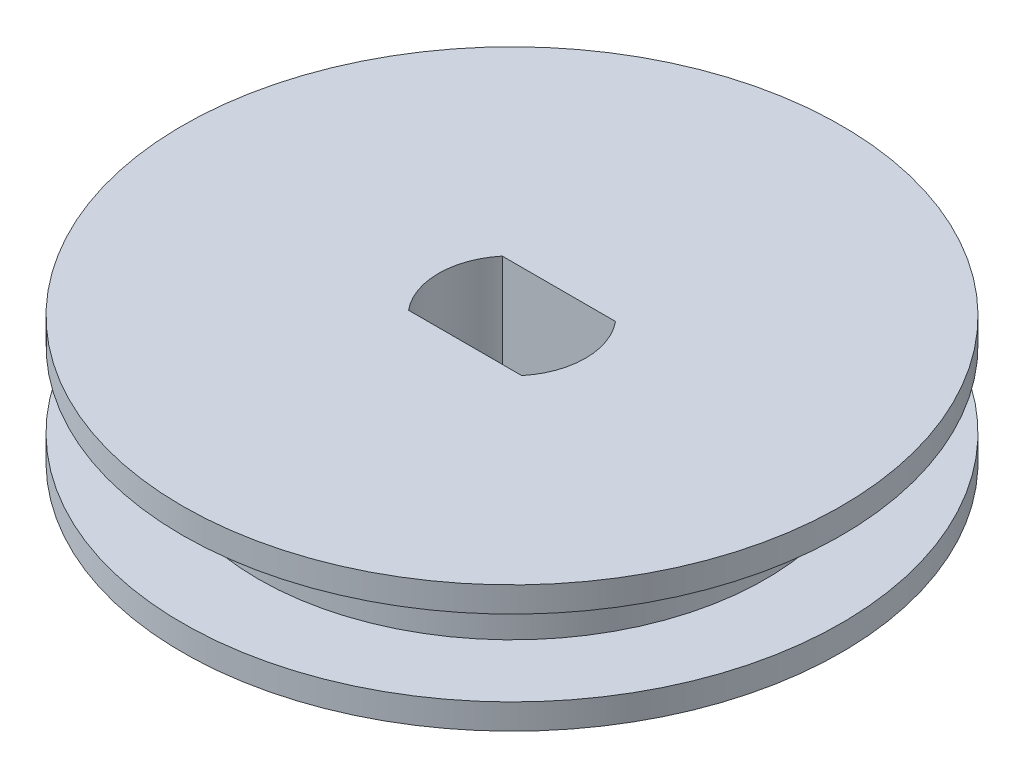
from build123d import *

# Parameters (mm, degrees)
SKETCH1_R               = 10
BOSS_EXTRUDE1_DEPTH     = 1
SKETCH2_R               = 10
BOSS_EXTRUDE2_DEPTH     = 4
SKETCH4_R               = 13
BOSS_EXTRUDE3_DEPTH     = 1
CUT_SWEEP1_START        = 4.993438222
CUT_SWEEP1_DEPTH        = 4.55597903
SKETCH9_R               = 1
CUT_EXTRUDE2_DEPTH      = 5
SKETCH10_R              = 2.5
SKETCH10_R_2            = 1
BOSS_EXTRUDE4_DEPTH     = 1
SKETCH11_R              = 13
SKETCH11_R_2            = 10
BOSS_EXTRUDE5_DEPTH     = 1
CUT_EXTRUDE4_DEPTH      = 20.05255902
CUT_EXTRUDE4_DEPTH_BACK = 20.05255902


# Read off the part's stored shape, not the designer's step: Cut-Sweep1
with BuildPart() as part:
    # Sketch1 → Boss-Extrude1 (new body)
    with BuildSketch(Plane(origin=(0, 0, 0), x_dir=(1, 0, 0), z_dir=(0, 1, 0))):
        with Locations(Location((0, 0, 0), (0, 0, 270))):
            Circle(SKETCH1_R)
    extrude(amount=BOSS_EXTRUDE1_DEPTH)

    # Sketch2 → Boss-Extrude2 (add)
    with BuildSketch(Plane(origin=(0, 0, 0), x_dir=(1, 0, 0), z_dir=(0, 1, 0))):
        with Locations(Location((0, 0, 0), (0, 0, 270))):
            Circle(SKETCH2_R)
    extrude(amount=BOSS_EXTRUDE2_DEPTH)

    # Sketch4 → Boss-Extrude3 (add)
    with BuildSketch(Plane(origin=(0, 4, 0), x_dir=(1, 0, 0), z_dir=(0, 1, 0))):
        with Locations(Location((0, 0, 0), (0, 0, 270))):
            Circle(SKETCH4_R)
    extrude(amount=BOSS_EXTRUDE3_DEPTH)

    # Cut-Sweep1 outline → Cut-Sweep1 (cut)
    with BuildSketch(Plane(origin=(0, 0, 0), x_dir=(1, 0, 0), z_dir=(0, 0.6401843996644766, 0.7682212795973786)).offset(CUT_SWEEP1_START)):
        with BuildLine():
            add(Edge.make_bspline(
                [(0, -4.801382997), (1, -4.801382997), (1, -4.161198598), (0, -4.161198598), (-1, -4.161198598), (-1, -4.801382997), (0, -4.801382997)],
                knots=[0, 0, 0, 0, 0.5, 0.5, 0.5, 1, 1, 1, 1], degree=3, weights=[1, 0.333333333, 0.333333333, 1, 0.333333333, 0.333333333, 1]))
        make_face()
    extrude(amount=CUT_SWEEP1_DEPTH, mode=Mode.SUBTRACT)

    # Sketch9 → Cut-Extrude2 (cut)
    with BuildSketch(Plane(origin=(0, 0, 0), x_dir=(1, 0, 0), z_dir=(0, 1, 0))):
        with Locations(Location((0, 0, 0), (0, 0, 270))):
            Circle(SKETCH9_R)
    extrude(amount=CUT_EXTRUDE2_DEPTH, mode=Mode.SUBTRACT)

    # Sketch10 → Boss-Extrude4 (add)
    with BuildSketch(Plane(origin=(0, 0, 0), x_dir=(1, 0, 0), z_dir=(0, 1, 0))):
        Circle(SKETCH10_R)
        with Locations(Location((0, 0, 0), (0, 0, 270))):
            Circle(SKETCH10_R_2, mode=Mode.SUBTRACT)
    extrude(amount=BOSS_EXTRUDE4_DEPTH)

    # Sketch11 → Boss-Extrude5 (add)
    with BuildSketch(Plane(origin=(0, 0, 0), x_dir=(-1, 0, 0), z_dir=(0, -1, 0))):
        with Locations(Location((0, 0, 0), (0, 0, 270))):
            Circle(SKETCH11_R)
        with Locations(Location((0, 0, 0), (0, 0, 90))):
            Circle(SKETCH11_R_2, mode=Mode.SUBTRACT)
    extrude(amount=-BOSS_EXTRUDE5_DEPTH)

    # Sketch12 → Cut-Extrude4 (cut, two sides: drawn at the far end of the back side and taken through both)
    with BuildSketch(Plane(origin=(0, 0, 0), x_dir=(1, 0, 0), z_dir=(0, 1, 0)).offset(-CUT_EXTRUDE4_DEPTH_BACK)):
        with BuildLine():
            Line((-2.233271143, 1.85), (2.233271143, 1.85))
            ThreePointArc((2.233271143, 1.85), (2.9, 0), (2.233271143, -1.85))
            Line((2.233271143, -1.85), (-2.233271143, -1.85))
            ThreePointArc((-2.233271143, -1.85), (-2.9, 0), (-2.233271143, 1.85))
        make_face()
    extrude(amount=CUT_EXTRUDE4_DEPTH + CUT_EXTRUDE4_DEPTH_BACK, mode=Mode.SUBTRACT)


solid = part.part
